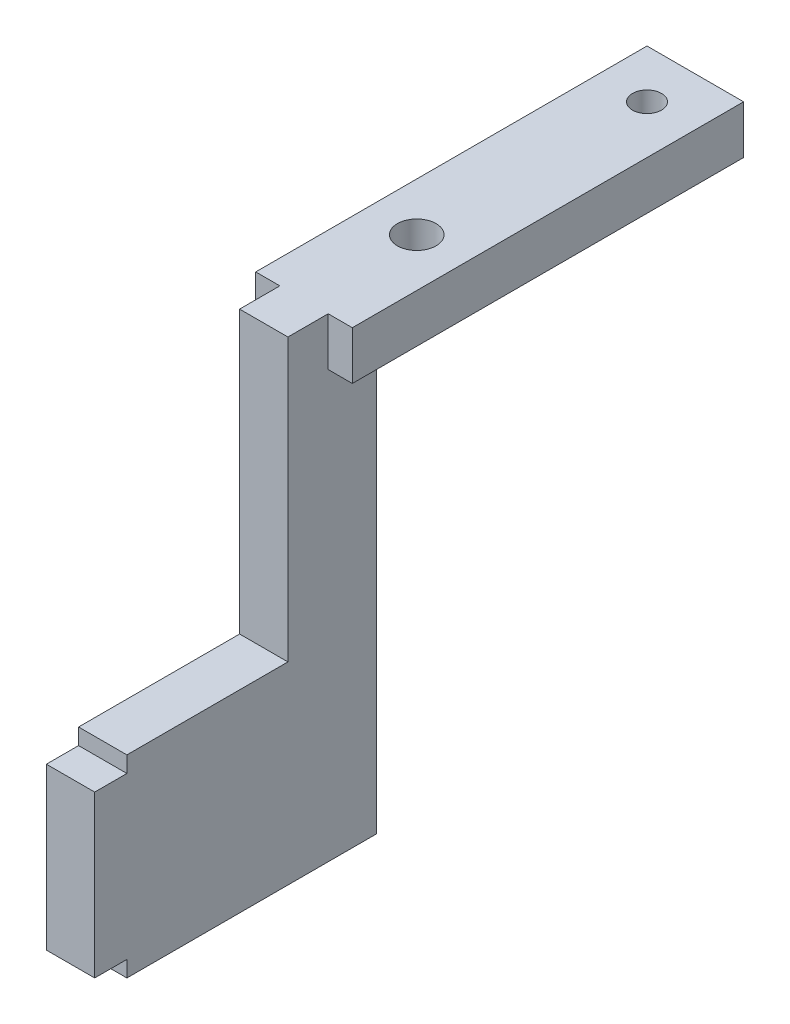
from build123d import *

# Parameters (mm, degrees)
BOSS_EXTRUDE1_START     = 7.2
SKETCH1_W               = 6
SKETCH1_H               = 3
BOSS_EXTRUDE1_DEPTH     = 24.3
BOSS_EXTRUDE2_START     = 28.5
SKETCH2_W               = 3
SKETCH2_H               = 29.475
BOSS_EXTRUDE2_DEPTH     = 17.5
CUT_EXTRUDE1_DEPTH      = 56.675089807
CUT_EXTRUDE1_DEPTH_BACK = 56.675089807
SKETCH3_R               = 1.2
SKETCH3_R_2             = 0.9
CUT_EXTRUDE2_DEPTH      = 56.675089807
CUT_EXTRUDE2_DEPTH_BACK = 56.675089807
SKETCH4_W               = 13
SKETCH4_H               = 18.475
CUT_EXTRUDE3_DEPTH      = 56.675089807
CUT_EXTRUDE3_DEPTH_BACK = 56.675089807
SKETCH5_W               = 3
SKETCH5_H               = 2.5


with BuildPart() as part:
    # Sketch1 → Boss-Extrude1 (new body)
    with BuildSketch(Plane.XY.offset(BOSS_EXTRUDE1_START)):
        with Locations((17.8, 21.975)):
            Rectangle(SKETCH1_W, SKETCH1_H)
    extrude(amount=BOSS_EXTRUDE1_DEPTH)

    # Sketch2 → Boss-Extrude2 (add)
    with BuildSketch(Plane.XY.offset(BOSS_EXTRUDE2_START)):
        with Locations((17.8, 8.7375)):
            Rectangle(SKETCH2_W, SKETCH2_H)
    extrude(amount=BOSS_EXTRUDE2_DEPTH)

    # Sketch3 → Cut-Extrude1 (cut, two sides: drawn at the far end of the back side and taken through both)
    with BuildSketch(Plane(origin=(0, 0, 0), x_dir=(1, 0, 0), z_dir=(0, 1, 0)).offset(-CUT_EXTRUDE1_DEPTH_BACK)):
        with Locations((17.8, -24.5)):
            Circle(SKETCH3_R)
        with Locations((17.8, -10.2)):
            Circle(SKETCH3_R_2)
    extrude(amount=CUT_EXTRUDE1_DEPTH + CUT_EXTRUDE1_DEPTH_BACK, mode=Mode.SUBTRACT)

    # Sketch4 → Cut-Extrude2 (cut, two sides: drawn at the far end of the back side and taken through both)
    with BuildSketch(Plane(origin=(0, 0, 0), x_dir=(0, 0, -1), z_dir=(1, 0, 0)).offset(-CUT_EXTRUDE2_DEPTH_BACK)):
        with Locations((-40.5, 15.2375)):
            Rectangle(SKETCH4_W, SKETCH4_H)
    extrude(amount=CUT_EXTRUDE2_DEPTH + CUT_EXTRUDE2_DEPTH_BACK, mode=Mode.SUBTRACT)

    # Sketch5 → Cut-Extrude3 (cut, two sides: drawn at the far end of the back side and taken through both)
    with BuildSketch(Plane(origin=(0, 0, 0), x_dir=(0, 0, -1), z_dir=(1, 0, 0)).offset(-CUT_EXTRUDE3_DEPTH_BACK)):
        with Locations((-45.5, -6.25)):
            Rectangle(SKETCH5_W, SKETCH5_H)
        with Locations((-45.5, 6.25)):
            Rectangle(SKETCH5_W, SKETCH5_H)
    extrude(amount=CUT_EXTRUDE3_DEPTH + CUT_EXTRUDE3_DEPTH_BACK, mode=Mode.SUBTRACT)


solid = part.part
